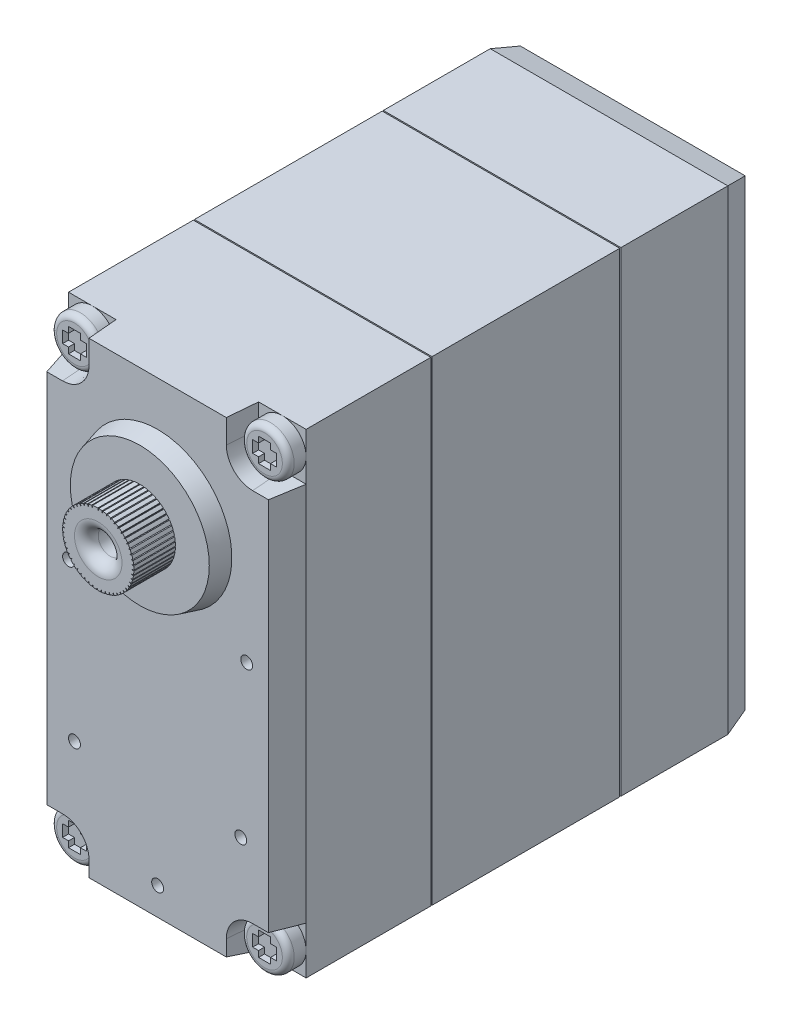
from build123d import *
from OCP.BRepFilletAPI import BRepFilletAPI_MakeChamfer

# Parameters (mm, degrees)
SKETCH1_W           = 20
SKETCH1_H           = 40
BOSS_EXTRUDE1_DEPTH = 40
SKETCH2_R           = 3
BOSS_EXTRUDE2_DEPTH = 5
SKETCH3_R           = 6.25
BOSS_EXTRUDE3_DEPTH = 1.5
BOSS_EXTRUDE4_START = 5
SKETCH4_R           = 3
BOSS_EXTRUDE4_DEPTH = 5
BOSS_EXTRUDE5_START = 1.5
SKETCH5_R           = 6.25
BOSS_EXTRUDE5_DEPTH = 1.5
CHAMFER1_SIZE       = 1.5
CHAMFER1_SIZE_2     = 0.401923789
SKETCH6_R           = 1
CUT_EXTRUDE1_DEPTH  = 8.5
CUT_EXTRUDE2_START  = 8.5
SKETCH7_R           = 1
CUT_EXTRUDE2_DEPTH  = 8.5
FILLET1_R           = 0.2
SKETCH8_R           = 0.5
CUT_EXTRUDE3_DEPTH  = 1
SKETCH9_R           = 0.5
CUT_EXTRUDE4_DEPTH  = 1
CUT_EXTRUDE6_DEPTH  = 10
CIRPATTERN1_COUNT   = 51
CIRPATTERN1_ANGLE   = 350
FILLET2_R           = 1
CHAMFER2_SIZE       = 2.5
CHAMFER2_SIZE2      = 0.669872981
CHAMFER3_SIZE       = 2
CHAMFER3_SIZE2      = 0.535898385
CUT_EXTRUDE7_DEPTH  = 2.5
CHAMFER4_SIZE       = 0.218721659
CHAMFER4_SIZE_2     = 2.5
BOSS_EXTRUDE6_START = 1.5
SKETCH12_R          = 2
BOSS_EXTRUDE6_DEPTH = 1.5
FILLET3_R           = 0.5
CUT_EXTRUDE8_DEPTH  = 0.5
SKETCH14_W          = 20
SKETCH14_H          = 40
SKETCH14_W_2        = 19.8
SKETCH14_H_2        = 39.8
CUT_EXTRUDE9_DEPTH  = 0.1
SKETCH15_W          = 20
SKETCH15_H          = 40
SKETCH15_W_2        = 19.8
SKETCH15_H_2        = 39.8
CUT_EXTRUDE10_DEPTH = 0.1


with BuildPart() as part:
    # Sketch1 → Boss-Extrude1 (new body)
    with BuildSketch(Plane.XY):
        Rectangle(SKETCH1_W, SKETCH1_H)
    extrude(amount=BOSS_EXTRUDE1_DEPTH)

    # Sketch2 → Boss-Extrude2 (add)
    with BuildSketch(Plane.XY.offset(40)):
        with Locations(Location((0, 10, 0), (0, 0, 180))):
            Circle(SKETCH2_R)
    extrude(amount=BOSS_EXTRUDE2_DEPTH)

    # Sketch3 → Boss-Extrude3 (add)
    with BuildSketch(Plane.XY.offset(40)):
        with Locations(Location((0, 10, 0), (0, 0, 180))):
            Circle(SKETCH3_R)
    extrude(amount=BOSS_EXTRUDE3_DEPTH)

    # Sketch4 → Boss-Extrude4 (add)
    with BuildSketch(Plane(origin=(0, 0, 0), x_dir=(-1, 0, 0), z_dir=(0, 0, -1)).offset(BOSS_EXTRUDE4_START)):
        with Locations(Location((0, 10, 0), (0, 0, 180))):
            Circle(SKETCH4_R)
    extrude(amount=-BOSS_EXTRUDE4_DEPTH)

    # Sketch5 → Boss-Extrude5 (add)
    with BuildSketch(Plane(origin=(0, 0, 0), x_dir=(-1, 0, 0), z_dir=(0, 0, -1)).offset(BOSS_EXTRUDE5_START)):
        with Locations((0, 10)):
            Circle(SKETCH5_R)
    extrude(amount=-BOSS_EXTRUDE5_DEPTH)

    # Chamfer1
    chamfer1_edges_1 = [part.edges().sort_by_distance(p)[0] for p in [
        (6.25, 10, 41.5),
    ]]
    chamfer1_side_1 = [part.faces().sort_by_distance(p)[0] for p in [
        (6.25, 10, 41.491961524),
    ]]
    chamfer1_edges_2 = [part.edges().sort_by_distance(p)[0] for p in [
        (6.25, 10, -1.5),
    ]]
    chamfer1_side_2 = [part.faces().sort_by_distance(p)[0] for p in [
        (6.25, 10, -1.491961524),
    ]]
    chamfer1 = BRepFilletAPI_MakeChamfer(part.part.solid().wrapped)
    for e in chamfer1_edges_1:
        chamfer1.Add(CHAMFER1_SIZE - 0.0001, CHAMFER1_SIZE_2 - 0.0001, e.wrapped, chamfer1_side_1[0].wrapped)
    for e in chamfer1_edges_2:
        chamfer1.Add(CHAMFER1_SIZE - 0.0001, CHAMFER1_SIZE_2 - 0.0001, e.wrapped, chamfer1_side_2[0].wrapped)
    add(Compound.cast(chamfer1.Shape()), mode=Mode.REPLACE)  # a hair under: the kernel refuses the full size

    # Sketch6 → Cut-Extrude1 (cut)
    with BuildSketch(Plane.XY.offset(40)):
        with Locations((0, 10)):
            Circle(SKETCH6_R)
    extrude(amount=CUT_EXTRUDE1_DEPTH, mode=Mode.SUBTRACT)

    # Sketch7 → Cut-Extrude2 (cut)
    with BuildSketch(Plane(origin=(0, 0, 0), x_dir=(-1, 0, 0), z_dir=(0, 0, -1)).offset(CUT_EXTRUDE2_START)):
        with Locations(Location((0, 10, 0), (0, 0, 180))):
            Circle(SKETCH7_R)
    extrude(amount=-CUT_EXTRUDE2_DEPTH, mode=Mode.SUBTRACT)

    # Fillet1
    fillet1_edges = [part.edges().sort_by_distance(p)[0] for p in [
        (-3, 10, -5),
    ]]
    fillet(fillet1_edges, radius=FILLET1_R)

    # Sketch8 → Cut-Extrude3 (cut)
    with BuildSketch(Plane(origin=(0, 0, 0), x_dir=(-1, 0, 0), z_dir=(0, 0, -1))):
        with Locations((-7.5, -17.5)):
            Circle(SKETCH8_R)
        with Locations((7.5, -17.5)):
            Circle(SKETCH8_R)
        with Locations((7.5, -2.5)):
            Circle(SKETCH8_R)
        with Locations((-7.5, -2.5)):
            Circle(SKETCH8_R)
    extrude(amount=-CUT_EXTRUDE3_DEPTH, mode=Mode.SUBTRACT)

    # Sketch9 → Cut-Extrude4 (cut)
    with BuildSketch(Plane.XY.offset(40)):
        with Locations((-7, -10)):
            Circle(SKETCH9_R)
        with Locations((7, -10)):
            Circle(SKETCH9_R)
        with Locations((0, -17)):
            Circle(SKETCH9_R)
        with Locations((-7.5, 3)):
            Circle(SKETCH9_R)
        with Locations(Location((7.5, 3, 0), (0, 0, 180))):
            Circle(SKETCH9_R)
    extrude(amount=-CUT_EXTRUDE4_DEPTH, mode=Mode.SUBTRACT)

    # Sketch10 → Cut-Extrude6 (cut)
    with BuildSketch(Plane.XY.offset(41.5)):
        with BuildLine():
            Line((-0.009377583, 12.853182918), (-0.035228922, 12.999793147))
            ThreePointArc((-0.035228922, 12.999793147), (0.00176623, 12.99999948), (0.038761113, 12.999749586))
            Line((0.038761113, 12.999749586), (0.010287376, 12.853014448))
            ThreePointArc((0.010287376, 12.853014448), (0.000384827, 12.844919766), (-0.009377583, 12.853182918))
        make_face()
    cut_extrude6 = extrude(amount=CUT_EXTRUDE6_DEPTH, mode=Mode.SUBTRACT)

    # CirPattern1: Cut-Extrude6 ×51 about axis
    cirpattern1_axis = Axis((0, 10, 0), (0, 0, -1))
    for i in range(1, CIRPATTERN1_COUNT):
        add(cut_extrude6.rotate(cirpattern1_axis, i * CIRPATTERN1_ANGLE / (CIRPATTERN1_COUNT - 1)), mode=Mode.SUBTRACT)

    # Fillet2
    fillet2_edges = [part.edges().sort_by_distance(p)[0] for p in [
        (-1, 10, 45),
    ]]
    fillet(fillet2_edges, radius=FILLET2_R)

    # Chamfer2: one chamfer whose edges measure the first distance from different faces: ONE call of the kernel's chamfer builder (chamfer() names one face for all edges)
    chamfer2_edges_1 = [part.edges().sort_by_distance(p)[0] for p in [
        (10, 0, 40),
    ]]
    chamfer2_side_1 = [part.faces().sort_by_distance(p)[0] for p in [
        (10, 0, 20),
    ]]
    chamfer2_edges_2 = [part.edges().sort_by_distance(p)[0] for p in [
        (-10, 0, 40),
    ]]
    chamfer2_side_2 = [part.faces().sort_by_distance(p)[0] for p in [
        (-10, 0, 20),
    ]]
    chamfer2_edges_3 = [part.edges().sort_by_distance(p)[0] for p in [
        (0, -20, 40),
    ]]
    chamfer2_side_3 = [part.faces().sort_by_distance(p)[0] for p in [
        (0, -20, 20),
    ]]
    chamfer2 = BRepFilletAPI_MakeChamfer(part.part.solid().wrapped)
    for e in chamfer2_edges_1:
        chamfer2.Add(CHAMFER2_SIZE, CHAMFER2_SIZE2, e.wrapped, chamfer2_side_1[0].wrapped)  # the first distance lies on this face
    for e in chamfer2_edges_2:
        chamfer2.Add(CHAMFER2_SIZE, CHAMFER2_SIZE2, e.wrapped, chamfer2_side_2[0].wrapped)  # the first distance lies on this face
    for e in chamfer2_edges_3:
        chamfer2.Add(CHAMFER2_SIZE, CHAMFER2_SIZE2, e.wrapped, chamfer2_side_3[0].wrapped)  # the first distance lies on this face
    add(Compound.cast(chamfer2.Shape()), mode=Mode.REPLACE)

    # Chamfer3: one chamfer whose edges measure the first distance from different faces: ONE call of the kernel's chamfer builder (chamfer() names one face for all edges)
    chamfer3_edges_1 = [part.edges().sort_by_distance(p)[0] for p in [
        (0, 20, 0),
    ]]
    chamfer3_side_1 = [part.faces().sort_by_distance(p)[0] for p in [
        (0, 20, 19.959793233),
    ]]
    chamfer3_edges_2 = [part.edges().sort_by_distance(p)[0] for p in [
        (10, 0, 0),
    ]]
    chamfer3_side_2 = [part.faces().sort_by_distance(p)[0] for p in [
        (10, 0, 18.75),
    ]]
    chamfer3_edges_3 = [part.edges().sort_by_distance(p)[0] for p in [
        (0, -20, 0),
    ]]
    chamfer3_side_3 = [part.faces().sort_by_distance(p)[0] for p in [
        (0, -20, 18.75),
    ]]
    chamfer3_edges_4 = [part.edges().sort_by_distance(p)[0] for p in [
        (-10, 0, 0),
    ]]
    chamfer3_side_4 = [part.faces().sort_by_distance(p)[0] for p in [
        (-10, 0, 18.75),
    ]]
    chamfer3 = BRepFilletAPI_MakeChamfer(part.part.solid().wrapped)
    for e in chamfer3_edges_1:
        chamfer3.Add(CHAMFER3_SIZE, CHAMFER3_SIZE2, e.wrapped, chamfer3_side_1[0].wrapped)  # the first distance lies on this face
    for e in chamfer3_edges_2:
        chamfer3.Add(CHAMFER3_SIZE, CHAMFER3_SIZE2, e.wrapped, chamfer3_side_2[0].wrapped)  # the first distance lies on this face
    for e in chamfer3_edges_3:
        chamfer3.Add(CHAMFER3_SIZE, CHAMFER3_SIZE2, e.wrapped, chamfer3_side_3[0].wrapped)  # the first distance lies on this face
    for e in chamfer3_edges_4:
        chamfer3.Add(CHAMFER3_SIZE, CHAMFER3_SIZE2, e.wrapped, chamfer3_side_4[0].wrapped)  # the first distance lies on this face
    add(Compound.cast(chamfer3.Shape()), mode=Mode.REPLACE)

    # Sketch11 → Cut-Extrude7 (cut)
    with BuildSketch(Plane.XY.offset(40)):
        with BuildLine():
            Line((-10, -20), (-10, -16))
            Line((-10, -16), (-8, -16))
            ThreePointArc((-8, -16), (-6.585786438, -16.585786438), (-6, -18))
            Line((-6, -18), (-6, -20))
            Line((-6, -20), (-10, -20))
        make_face()
        with BuildLine():
            Line((-6, 20), (-10, 20))
            Line((-10, 20), (-10, 16))
            Line((-10, 16), (-8, 16))
            ThreePointArc((-8, 16), (-6.585786438, 16.585786438), (-6, 18))
            Line((-6, 18), (-6, 20))
        make_face()
        with BuildLine():
            Line((10, 20), (10, 16))
            Line((10, 16), (8, 16))
            ThreePointArc((8, 16), (6.585786438, 16.585786438), (6, 18))
            Line((6, 18), (6, 20))
            Line((6, 20), (10, 20))
        make_face()
        with BuildLine():
            Line((6, -20), (10, -20))
            Line((10, -20), (10, -16))
            Line((10, -16), (8, -16))
            ThreePointArc((8, -16), (6.585786438, -16.585786438), (6, -18))
            Line((6, -18), (6, -20))
        make_face()
    extrude(amount=-CUT_EXTRUDE7_DEPTH, mode=Mode.SUBTRACT)

    # Chamfer4
    chamfer4_edges_1 = [part.edges().sort_by_distance(p)[0] for p in [
        (-8.665063509, 16, 40),
    ]]
    chamfer4_side_1 = [part.faces().sort_by_distance(p)[0] for p in [
        (-8.665063509, 15.995625567, 40),
    ]]
    chamfer4_edges_2 = [part.edges().sort_by_distance(p)[0] for p in [
        (-6, 19, 40),
    ]]
    chamfer4_side_2 = [part.faces().sort_by_distance(p)[0] for p in [
        (-6, 19, 39.995625567),
    ]]
    chamfer4_edges_3 = [part.edges().sort_by_distance(p)[0] for p in [
        (-6.585786438, 16.585786438, 40),
    ]]
    chamfer4_side_3 = [part.faces().sort_by_distance(p)[0] for p in [
        (-6.582693246, 16.582693246, 40),
    ]]
    chamfer4_edges_4 = [part.edges().sort_by_distance(p)[0] for p in [
        (-6, -18.665063509, 40),
    ]]
    chamfer4_side_4 = [part.faces().sort_by_distance(p)[0] for p in [
        (-5.995625567, -18.665063509, 40),
    ]]
    chamfer4_edges_5 = [part.edges().sort_by_distance(p)[0] for p in [
        (-8.665063509, -16, 40),
    ]]
    chamfer4_side_5 = [part.faces().sort_by_distance(p)[0] for p in [
        (-8.665063509, -15.995625567, 40),
    ]]
    chamfer4_edges_6 = [part.edges().sort_by_distance(p)[0] for p in [
        (-6.585786438, -16.585786438, 40),
    ]]
    chamfer4_side_6 = [part.faces().sort_by_distance(p)[0] for p in [
        (-6.582693246, -16.582693246, 40),
    ]]
    chamfer4_edges_7 = [part.edges().sort_by_distance(p)[0] for p in [
        (8.665063509, -16, 40),
    ]]
    chamfer4_side_7 = [part.faces().sort_by_distance(p)[0] for p in [
        (8.665063509, -15.995625567, 40),
    ]]
    chamfer4_edges_8 = [part.edges().sort_by_distance(p)[0] for p in [
        (6, -18.665063509, 40),
    ]]
    chamfer4_side_8 = [part.faces().sort_by_distance(p)[0] for p in [
        (5.995625567, -18.665063509, 40),
    ]]
    chamfer4_edges_9 = [part.edges().sort_by_distance(p)[0] for p in [
        (6.585786438, -16.585786438, 40),
    ]]
    chamfer4_side_9 = [part.faces().sort_by_distance(p)[0] for p in [
        (6.582693246, -16.582693246, 40),
    ]]
    chamfer4_edges_10 = [part.edges().sort_by_distance(p)[0] for p in [
        (6, 19, 40),
    ]]
    chamfer4_side_10 = [part.faces().sort_by_distance(p)[0] for p in [
        (5.995625567, 19, 40),
    ]]
    chamfer4_edges_11 = [part.edges().sort_by_distance(p)[0] for p in [
        (8.665063509, 16, 40),
    ]]
    chamfer4_side_11 = [part.faces().sort_by_distance(p)[0] for p in [
        (8.665063509, 15.995625567, 40),
    ]]
    chamfer4_edges_12 = [part.edges().sort_by_distance(p)[0] for p in [
        (6.585786438, 16.585786438, 40),
    ]]
    chamfer4_side_12 = [part.faces().sort_by_distance(p)[0] for p in [
        (6.582693246, 16.582693246, 40),
    ]]
    chamfer4 = BRepFilletAPI_MakeChamfer(part.part.solid().wrapped)
    for e in chamfer4_edges_1:
        chamfer4.Add(CHAMFER4_SIZE - 0.0001, CHAMFER4_SIZE_2 - 0.0001, e.wrapped, chamfer4_side_1[0].wrapped)
    for e in chamfer4_edges_2:
        chamfer4.Add(CHAMFER4_SIZE_2 - 0.0001, CHAMFER4_SIZE - 0.0001, e.wrapped, chamfer4_side_2[0].wrapped)
    for e in chamfer4_edges_3:
        chamfer4.Add(CHAMFER4_SIZE - 0.0001, CHAMFER4_SIZE_2 - 0.0001, e.wrapped, chamfer4_side_3[0].wrapped)
    for e in chamfer4_edges_4:
        chamfer4.Add(CHAMFER4_SIZE - 0.0001, CHAMFER4_SIZE_2 - 0.0001, e.wrapped, chamfer4_side_4[0].wrapped)
    for e in chamfer4_edges_5:
        chamfer4.Add(CHAMFER4_SIZE - 0.0001, CHAMFER4_SIZE_2 - 0.0001, e.wrapped, chamfer4_side_5[0].wrapped)
    for e in chamfer4_edges_6:
        chamfer4.Add(CHAMFER4_SIZE - 0.0001, CHAMFER4_SIZE_2 - 0.0001, e.wrapped, chamfer4_side_6[0].wrapped)
    for e in chamfer4_edges_7:
        chamfer4.Add(CHAMFER4_SIZE - 0.0001, CHAMFER4_SIZE_2 - 0.0001, e.wrapped, chamfer4_side_7[0].wrapped)
    for e in chamfer4_edges_8:
        chamfer4.Add(CHAMFER4_SIZE - 0.0001, CHAMFER4_SIZE_2 - 0.0001, e.wrapped, chamfer4_side_8[0].wrapped)
    for e in chamfer4_edges_9:
        chamfer4.Add(CHAMFER4_SIZE - 0.0001, CHAMFER4_SIZE_2 - 0.0001, e.wrapped, chamfer4_side_9[0].wrapped)
    for e in chamfer4_edges_10:
        chamfer4.Add(CHAMFER4_SIZE - 0.0001, CHAMFER4_SIZE_2 - 0.0001, e.wrapped, chamfer4_side_10[0].wrapped)
    for e in chamfer4_edges_11:
        chamfer4.Add(CHAMFER4_SIZE - 0.0001, CHAMFER4_SIZE_2 - 0.0001, e.wrapped, chamfer4_side_11[0].wrapped)
    for e in chamfer4_edges_12:
        chamfer4.Add(CHAMFER4_SIZE - 0.0001, CHAMFER4_SIZE_2 - 0.0001, e.wrapped, chamfer4_side_12[0].wrapped)
    add(Compound.cast(chamfer4.Shape()), mode=Mode.REPLACE)  # a hair under: the kernel refuses the full size

    # Sketch12 → Boss-Extrude6 (add)
    with BuildSketch(Plane.XY.offset(37.5).offset(BOSS_EXTRUDE6_START)):
        with Locations((8, -18)):
            Circle(SKETCH12_R)
        with Locations(Location((-8, -18, 0), (0, 0, 180))):
            Circle(SKETCH12_R)
        with Locations((-8, 18)):
            Circle(SKETCH12_R)
        with Locations(Location((8, 18, 0), (0, 0, 180))):
            Circle(SKETCH12_R)
    extrude(amount=-BOSS_EXTRUDE6_DEPTH)

    # Fillet3
    fillet3_edges = [part.edges().sort_by_distance(p)[0] for p in [
        (6, -18, 39),
        (-6, -18, 39),
        (-10, 18, 39),
        (10, 18, 39),
    ]]
    fillet(fillet3_edges, radius=FILLET3_R)

    # Sketch13 → Cut-Extrude8 (cut)
    with BuildSketch(Plane.XY.offset(39)):
        Polygon((-8.5, -17), (-7.5, -17), (-7.5, -17.5), (-7, -17.5), (-7, -18.5), (-7.5, -18.5), (-7.5, -19), (-8.5, -19), (-8.5, -18.5), (-9, -18.5), (-9, -17.5), (-8.5, -17.5), align=None)
        Polygon((8.5, -18.5), (9, -18.5), (9, -17.5), (8.5, -17.5), (8.5, -17), (7.5, -17), (7.5, -17.5), (7, -17.5), (7, -18.5), (7.5, -18.5), (7.5, -19), (8.5, -19), align=None)
        Polygon((8.5, 17), (7.5, 17), (7.5, 17.5), (7, 17.5), (7, 18.5), (7.5, 18.5), (7.5, 19), (8.5, 19), (8.5, 18.5), (9, 18.5), (9, 17.5), (8.5, 17.5), align=None)
        Polygon((-8.5, 18.5), (-9, 18.5), (-9, 17.5), (-8.5, 17.5), (-8.5, 17), (-7.5, 17), (-7.5, 17.5), (-7, 17.5), (-7, 18.5), (-7.5, 18.5), (-7.5, 19), (-8.5, 19), align=None)
    extrude(amount=-CUT_EXTRUDE8_DEPTH, mode=Mode.SUBTRACT)

    # Sketch14 → Cut-Extrude9 (cut)
    with BuildSketch(Plane.XY.offset(27)):
        Rectangle(SKETCH14_W, SKETCH14_H)
        Rectangle(SKETCH14_W_2, SKETCH14_H_2, mode=Mode.SUBTRACT)
    extrude(amount=-CUT_EXTRUDE9_DEPTH, mode=Mode.SUBTRACT)

    # Sketch15 → Cut-Extrude10 (cut)
    with BuildSketch(Plane(origin=(0, 0, 11), x_dir=(-1, 0, 0), z_dir=(0, 0, -1))):
        Rectangle(SKETCH15_W, SKETCH15_H)
        Rectangle(SKETCH15_W_2, SKETCH15_H_2, mode=Mode.SUBTRACT)
    extrude(amount=-CUT_EXTRUDE10_DEPTH, mode=Mode.SUBTRACT)


solid = part.part
